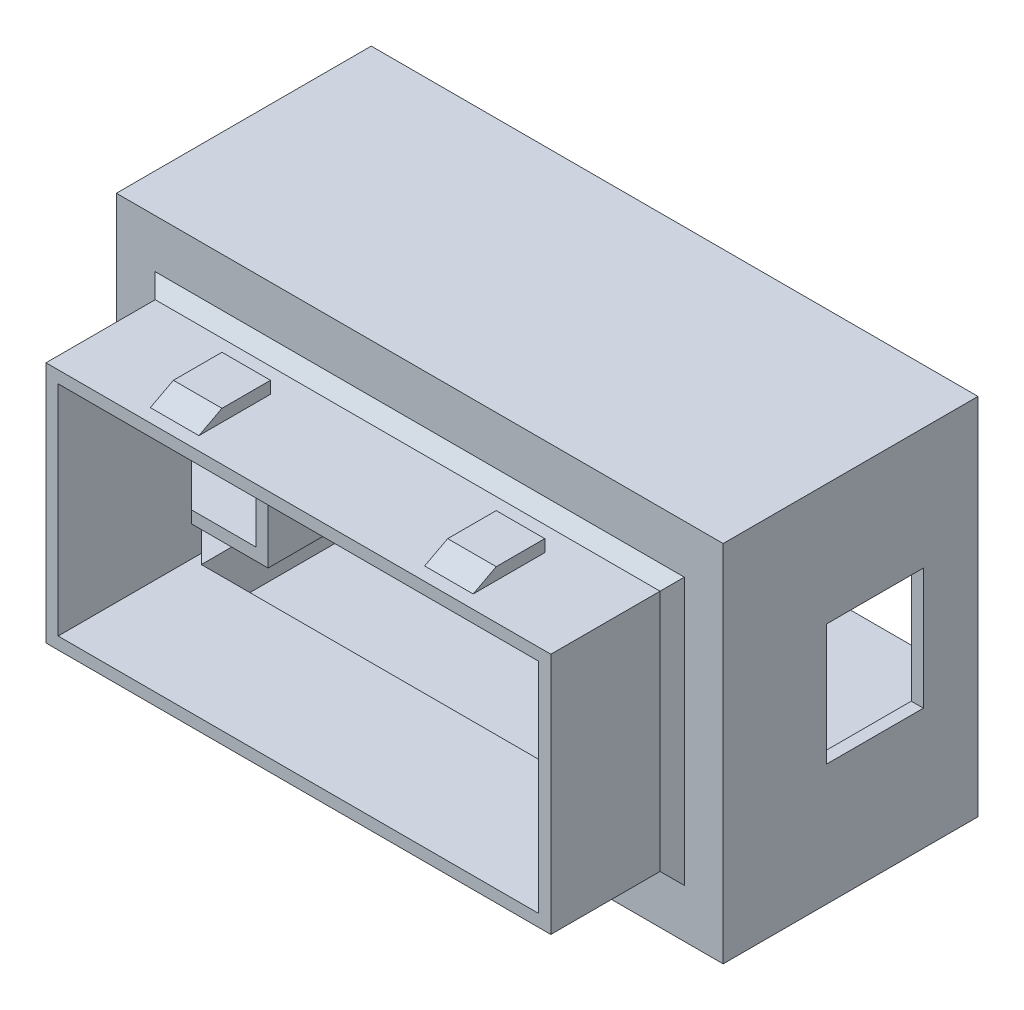
from build123d import *

# Parameters (mm, degrees)
SKETCH1_W            = 41.6
SKETCH1_H            = 20
SKETCH1_W_2          = 39.6
SKETCH1_H_2          = 18
BOSS_EXTRUDE2_DEPTH  = 10
SKETCH2_W            = 4
SKETCH2_H            = 10
BOSS_EXTRUDE3_DEPTH  = 1
SKETCH3_W            = 3
SKETCH3_H            = 1
CUT_EXTRUDE1_DEPTH   = 27
SKETCH4_W            = 4
SKETCH4_H            = 10
BOSS_EXTRUDE4_DEPTH  = 1
SKETCH5_W            = 3
SKETCH5_H            = 1
CUT_EXTRUDE2_DEPTH   = 27
SKETCH6_W            = 50
SKETCH6_H            = 30
SKETCH6_W_2          = 41.6
SKETCH6_H_2          = 20
SKETCH6_W_3          = 39.6
SKETCH6_H_3          = 18
BOSS_EXTRUDE6_DEPTH  = 1
CHAMFER1_SIZE        = 1
SKETCH7_W            = 50
SKETCH7_H            = 30
SKETCH7_W_2          = 48
SKETCH7_H_2          = 28
BOSS_EXTRUDE7_DEPTH  = 20
SKETCH8_W            = 4.2
SKETCH8_H            = 1
BOSS_EXTRUDE8_DEPTH  = 20
SKETCH9_W            = 4.2
SKETCH9_H            = 1
BOSS_EXTRUDE9_DEPTH  = 20
SKETCH10_W           = 4
SKETCH10_H           = 4
BOSS_EXTRUDE10_DEPTH = 20
SKETCH11_W           = 2
SKETCH11_H           = 10
CUT_EXTRUDE3_DEPTH   = 1
SKETCH12_W           = 2
SKETCH12_H           = 10
CUT_EXTRUDE4_DEPTH   = 1
SKETCH13_R           = 1.5
CUT_EXTRUDE5_DEPTH   = 10
CHAMFER2_SIZE        = 5
CHAMFER3_SIZE        = 5
CHAMFER4_SIZE        = 4
SKETCH17_W           = 20
SKETCH17_H           = 14
CUT_EXTRUDE8_DEPTH   = 10
SKETCH18_W           = 4.2
SKETCH18_H           = 1
BOSS_EXTRUDE11_DEPTH = 20
CHAMFER5_SIZE        = 5
CHAMFER6_SIZE        = 5
CHAMFER7_SIZE        = 4
SKETCH19_W           = 20
SKETCH19_H           = 14
CUT_EXTRUDE9_DEPTH   = 10
SKETCH20_W           = 4.2
SKETCH20_H           = 1
BOSS_EXTRUDE12_DEPTH = 20
CHAMFER8_SIZE        = 4
CHAMFER9_SIZE        = 5


# Some blends are built 0.0001 mm under size
with BuildPart() as part:
    # Sketch1 → Boss-Extrude2 (new body)
    with BuildSketch(Plane.XY):
        Rectangle(SKETCH1_W, SKETCH1_H)
        Rectangle(SKETCH1_W_2, SKETCH1_H_2, mode=Mode.SUBTRACT)
    extrude(amount=BOSS_EXTRUDE2_DEPTH)

    # Sketch2 → Boss-Extrude3 (add)
    with BuildSketch(Plane.XZ.offset(10)):
        with Locations((-11.3, 5)):
            Rectangle(SKETCH2_W, SKETCH2_H)
        with Locations((11.3, 5)):
            Rectangle(SKETCH2_W, SKETCH2_H)
    extrude(amount=BOSS_EXTRUDE3_DEPTH)

    # Sketch3 → Cut-Extrude1 (cut)
    with BuildSketch(Plane.ZY.offset(13.3)):
        Polygon((8.900149248, -10), (7, -11), (10, -11), (10, -10), align=None)
        with Locations((1.5, -10.5)):
            Rectangle(SKETCH3_W, SKETCH3_H)
    extrude(amount=-CUT_EXTRUDE1_DEPTH, mode=Mode.SUBTRACT)

    # Sketch4 → Boss-Extrude4 (add)
    with BuildSketch(Plane(origin=(0, 10, 0), x_dir=(1, 0, 0), z_dir=(0, 1, 0))):
        with Locations((11.3, -5)):
            Rectangle(SKETCH4_W, SKETCH4_H)
        with Locations((-11.3, -5)):
            Rectangle(SKETCH4_W, SKETCH4_H)
    extrude(amount=BOSS_EXTRUDE4_DEPTH)

    # Sketch5 → Cut-Extrude2 (cut)
    with BuildSketch(Plane(origin=(13.3, 0, 0), x_dir=(0, 0, -1), z_dir=(1, 0, 0))):
        Polygon((-7, 11), (-10, 11), (-10, 10), (-8.900149248, 10), align=None)
        with Locations((-1.5, 10.5)):
            Rectangle(SKETCH5_W, SKETCH5_H)
    extrude(amount=-CUT_EXTRUDE2_DEPTH, mode=Mode.SUBTRACT)

    # Sketch6 → Boss-Extrude6 (add)
    # profile 1 of 2: a face of its own
    with BuildSketch(Plane(origin=(0, 0, 0), x_dir=(-1, 0, 0), z_dir=(0, 0, -1))):
        Rectangle(SKETCH6_W, SKETCH6_H)
        Rectangle(SKETCH6_W_2, SKETCH6_H_2, mode=Mode.SUBTRACT)
    # profile 2 of 2: a face of its own
    with BuildSketch(Plane(origin=(0, 0, 0), x_dir=(-1, 0, 0), z_dir=(0, 0, -1))):
        Rectangle(SKETCH6_W_2, SKETCH6_H_2)
        Rectangle(SKETCH6_W_3, SKETCH6_H_3, mode=Mode.SUBTRACT)
    extrude(amount=BOSS_EXTRUDE6_DEPTH)

    # Chamfer1
    chamfer1_edges = [part.edges().sort_by_distance(p)[0] for p in [
        (0, -10, 0),
        (-20.8, 0, 0),
        (0, 10, 0),
        (20.8, 0, 0),
    ]]
    chamfer(chamfer1_edges, length=CHAMFER1_SIZE)

    # Sketch7 → Boss-Extrude7 (add)
    with BuildSketch(Plane(origin=(0, 0, -1), x_dir=(-1, 0, 0), z_dir=(0, 0, -1))):
        Rectangle(SKETCH7_W, SKETCH7_H)
        Rectangle(SKETCH7_W_2, SKETCH7_H_2, mode=Mode.SUBTRACT)
    extrude(amount=BOSS_EXTRUDE7_DEPTH)

    # Sketch8 → Boss-Extrude8 (add)
    with BuildSketch(Plane(origin=(0, 0, -1), x_dir=(-1, 0, 0), z_dir=(0, 0, -1))):
        Polygon((-15, -5), (-19.8, -5), (-19.8, -6), (-14, -6), (-14, 6), (-19.8, 6), (-19.8, 5), (-15, 5), align=None)
        with Locations((-21.9, 5.5)):
            Rectangle(SKETCH8_W, SKETCH8_H)
        with Locations((-21.9, -5.5)):
            Rectangle(SKETCH8_W, SKETCH8_H)
    extrude(amount=BOSS_EXTRUDE8_DEPTH)

    # Sketch9 → Boss-Extrude9 (add)
    with BuildSketch(Plane(origin=(0, 0, -1), x_dir=(-1, 0, 0), z_dir=(0, 0, -1))):
        Polygon((15, 5), (19.8, 5), (19.8, 6), (14, 6), (14, -6), (19.8, -6), (19.8, -5), (15, -5), align=None)
        with Locations((21.9, 5.5)):
            Rectangle(SKETCH9_W, SKETCH9_H)
        with Locations((21.9, -5.5)):
            Rectangle(SKETCH9_W, SKETCH9_H)
    extrude(amount=BOSS_EXTRUDE9_DEPTH)

    # Sketch10 → Boss-Extrude10 (add)
    with BuildSketch(Plane(origin=(0, 0, -1), x_dir=(-1, 0, 0), z_dir=(0, 0, -1))):
        with Locations((-22, 12)):
            Rectangle(SKETCH10_W, SKETCH10_H)
        with Locations((22, 12)):
            Rectangle(SKETCH10_W, SKETCH10_H)
        with Locations((22, -12)):
            Rectangle(SKETCH10_W, SKETCH10_H)
        with Locations((-22, -12)):
            Rectangle(SKETCH10_W, SKETCH10_H)
    extrude(amount=BOSS_EXTRUDE10_DEPTH)

    # Sketch11 → Cut-Extrude3 (cut)
    with BuildSketch(Plane.ZY.offset(25)):
        Polygon((-10.5, -5), (-10.5, 5), (-16.5, 5), (-16.5, 0), (-16.5, -5), align=None)
        with Locations((-9.5, 0)):
            Rectangle(SKETCH11_W, SKETCH11_H)
    extrude(amount=-CUT_EXTRUDE3_DEPTH, mode=Mode.SUBTRACT)

    # Sketch12 → Cut-Extrude4 (cut)
    with BuildSketch(Plane(origin=(25, 0, 0), x_dir=(0, 0, -1), z_dir=(1, 0, 0))):
        with Locations((9.5, 0)):
            Rectangle(SKETCH12_W, SKETCH12_H)
        Polygon((16.5, 5), (10.5, 5), (10.5, -5), (16.5, -5), (16.5, 0), align=None)
    extrude(amount=-CUT_EXTRUDE4_DEPTH, mode=Mode.SUBTRACT)

    # Sketch13 → Cut-Extrude5 (cut)
    with BuildSketch(Plane(origin=(0, 0, -21), x_dir=(-1, 0, 0), z_dir=(0, 0, -1))):
        with Locations((-22.5, 12.5)):
            Circle(SKETCH13_R)
        with Locations((22.5, 12.5)):
            Circle(SKETCH13_R)
        with Locations((22.5, -12.5)):
            Circle(SKETCH13_R)
        with Locations((-22.5, -12.5)):
            Circle(SKETCH13_R)
    extrude(amount=-CUT_EXTRUDE5_DEPTH, mode=Mode.SUBTRACT)

    # Chamfer2
    chamfer2_edges = [part.edges().sort_by_distance(p)[0] for p in [
        (0, -14, -1),
        (0, 14, -1),
    ]]
    chamfer(chamfer2_edges, length=CHAMFER2_SIZE - 0.0001)  # a hair under: the kernel refuses the full size

    # Chamfer3
    # the kernel refuses this chamfer: 5 mm, written as the material it adds along each edge
    with BuildSketch(Plane(origin=(24, -21.85851494, -1), x_dir=(-0.9996219169112968, 0, 0.02749587661058636), z_dir=(0, 1, 0))) as chamfer3_piece_1_section:
        Polygon((CHAMFER3_SIZE * 0.999621916911, -CHAMFER3_SIZE * 0.0274958766106), (-CHAMFER3_SIZE * 0.0274958766106, -CHAMFER3_SIZE * 0.999621916911), (0, 0), align=None)
    chamfer3_piece_1 = extrude(amount=28.71692988, mode=Mode.PRIVATE)
    chamfer3_piece_1 = split(chamfer3_piece_1, bisect_by=Plane(origin=(19.8, -10.000025, -1.99995), z_dir=(1, 0, 0)), keep=Keep.TOP, mode=Mode.PRIVATE)
    chamfer3_piece_1 = split(chamfer3_piece_1, bisect_by=Plane(origin=(19.999975, -5, -1.99995), z_dir=(0, -1, 0)), keep=Keep.TOP, mode=Mode.PRIVATE)
    chamfer3_piece_1 = split(chamfer3_piece_1, bisect_by=Plane(origin=(19.999975, -10.0000375, -1.9999375), z_dir=(0, 0.7071067811865476, -0.7071067811865476)), keep=Keep.TOP, mode=Mode.PRIVATE)
    add(chamfer3_piece_1)
    with BuildSketch(Plane(origin=(24, -21.85851494, -1), x_dir=(-0.9996219169112968, 0, 0.02749587661058636), z_dir=(0, 1, 0))) as chamfer3_piece_2_section:
        Polygon((CHAMFER3_SIZE * 0.999621916911, -CHAMFER3_SIZE * 0.0274958766106), (-CHAMFER3_SIZE * 0.0274958766106, -CHAMFER3_SIZE * 0.999621916911), (0, 0), align=None)
    chamfer3_piece_2 = extrude(amount=28.71692988, mode=Mode.PRIVATE)
    chamfer3_piece_2 = split(chamfer3_piece_2, bisect_by=Plane(origin=(19.599975009, -9, -1.399950019), z_dir=(0, -1, 0)), keep=Keep.TOP, mode=Mode.PRIVATE)
    chamfer3_piece_2 = split(chamfer3_piece_2, bisect_by=Plane(origin=(19.599975009, -9.300037514, -1.299937514), z_dir=(0, 0.7071067811865476, -0.7071067811865476)), keep=Keep.TOP, mode=Mode.PRIVATE)
    add(chamfer3_piece_2)
    with BuildSketch(Plane(origin=(24, -21.85851494, -1), x_dir=(-0.9996219169112968, 0, 0.02749587661058636), z_dir=(0, 1, 0))) as chamfer3_piece_3_section:
        Polygon((CHAMFER3_SIZE * 0.999621916911, -CHAMFER3_SIZE * 0.0274958766106), (-CHAMFER3_SIZE * 0.0274958766106, -CHAMFER3_SIZE * 0.999621916911), (0, 0), align=None)
    chamfer3_piece_3 = extrude(amount=28.71692988, mode=Mode.PRIVATE)
    chamfer3_piece_3 = split(chamfer3_piece_3, bisect_by=Plane(origin=(19.8, 6.42920747, -1.451851852), z_dir=(1, 0, 0)), keep=Keep.TOP, mode=Mode.PRIVATE)
    chamfer3_piece_3 = split(chamfer3_piece_3, bisect_by=Plane(origin=(19.903703704, 5, -1.451851852), z_dir=(0, 1, 0)), keep=Keep.TOP, mode=Mode.PRIVATE)
    add(chamfer3_piece_3)
    with BuildSketch(Plane(origin=(-24, 6.85841494, -1), x_dir=(0.9996219169112968, 0, 0.02749587661058636), z_dir=(0, -1, 0))) as chamfer3_piece_4_section:
        Polygon((CHAMFER3_SIZE * 0.999621916911, -CHAMFER3_SIZE * 0.0274958766106), (-CHAMFER3_SIZE * 0.0274958766106, -CHAMFER3_SIZE * 0.999621916911), (0, 0), align=None)
    chamfer3_piece_4 = extrude(amount=28.71692988, mode=Mode.PRIVATE)
    chamfer3_piece_4 = split(chamfer3_piece_4, bisect_by=Plane(origin=(-19.8, 6.42920747, -1.451851852), z_dir=(-1, 0, 0)), keep=Keep.TOP, mode=Mode.PRIVATE)
    chamfer3_piece_4 = split(chamfer3_piece_4, bisect_by=Plane(origin=(-19.903703704, 5, -1.451851852), z_dir=(0, 1, 0)), keep=Keep.TOP, mode=Mode.PRIVATE)
    add(chamfer3_piece_4)
    with BuildSketch(Plane(origin=(-24, -6, -1), x_dir=(0.9996219169112968, 0, 0.02749587661058636), z_dir=(0, -1, 0))) as chamfer3_piece_5_section:
        Polygon((CHAMFER3_SIZE * 0.999621916911, -CHAMFER3_SIZE * 0.0274958766106), (-CHAMFER3_SIZE * 0.0274958766106, -CHAMFER3_SIZE * 0.999621916911), (0, 0), align=None)
    chamfer3_piece_5 = extrude(amount=15.85851494, mode=Mode.PRIVATE)
    chamfer3_piece_5 = split(chamfer3_piece_5, bisect_by=Plane(origin=(-19.8, -7.5, -1.451851852), z_dir=(-1, 0, 0)), keep=Keep.TOP, mode=Mode.PRIVATE)
    chamfer3_piece_5 = split(chamfer3_piece_5, bisect_by=Plane(origin=(-19.903703704, -8.475975926, -0.475875926), z_dir=(0, 0.7071067811865476, -0.7071067811865476)), keep=Keep.TOP, mode=Mode.PRIVATE)
    add(chamfer3_piece_5)
    with BuildSketch(Plane(origin=(-24, 6.85841494, -1), x_dir=(0.9996219169112968, 0, 0.02749587661058636), z_dir=(0, -1, 0))) as chamfer3_piece_6_section:
        Polygon((CHAMFER3_SIZE * 0.999621916911, -CHAMFER3_SIZE * 0.0274958766106), (-CHAMFER3_SIZE * 0.0274958766106, -CHAMFER3_SIZE * 0.999621916911), (0, 0), align=None)
    chamfer3_piece_6 = extrude(amount=28.71692988, mode=Mode.PRIVATE)
    chamfer3_piece_6 = split(chamfer3_piece_6, bisect_by=Plane(origin=(-19.599975009, -9, -1.399950019), z_dir=(0, -1, 0)), keep=Keep.TOP, mode=Mode.PRIVATE)
    chamfer3_piece_6 = split(chamfer3_piece_6, bisect_by=Plane(origin=(-19.599975009, -9.300037514, -1.299937514), z_dir=(0, 0.7071067811865476, -0.7071067811865476)), keep=Keep.TOP, mode=Mode.PRIVATE)
    add(chamfer3_piece_6)
    with BuildSketch(Plane(origin=(-24, 21.85851494, -1), x_dir=(0.9996219169112968, 0, 0.02749587661058636), z_dir=(0, -1, 0))) as chamfer3_piece_7_section:
        Polygon((CHAMFER3_SIZE * 0.999621916911, -CHAMFER3_SIZE * 0.0274958766106), (-CHAMFER3_SIZE * 0.0274958766106, -CHAMFER3_SIZE * 0.999621916911), (0, 0), align=None)
    chamfer3_piece_7 = extrude(amount=28.71692988, mode=Mode.PRIVATE)
    chamfer3_piece_7 = split(chamfer3_piece_7, bisect_by=Plane(origin=(-19.8, 10.000025, -1.99995), z_dir=(-1, 0, 0)), keep=Keep.TOP, mode=Mode.PRIVATE)
    chamfer3_piece_7 = split(chamfer3_piece_7, bisect_by=Plane(origin=(-19.999975, 15, -1.99995), z_dir=(0, -1, 0)), keep=Keep.TOP, mode=Mode.PRIVATE)
    chamfer3_piece_7 = split(chamfer3_piece_7, bisect_by=Plane(origin=(-19.999975, 5, -1.99995), z_dir=(0, 1, 0)), keep=Keep.TOP, mode=Mode.PRIVATE)
    add(chamfer3_piece_7)
    with BuildSketch(Plane(origin=(-24, 21.85851494, -1), x_dir=(0.9996219169112968, 0, 0.02749587661058636), z_dir=(0, -1, 0))) as chamfer3_piece_8_section:
        Polygon((CHAMFER3_SIZE * 0.999621916911, -CHAMFER3_SIZE * 0.0274958766106), (-CHAMFER3_SIZE * 0.0274958766106, -CHAMFER3_SIZE * 0.999621916911), (0, 0), align=None)
    chamfer3_piece_8 = extrude(amount=28.71692988, mode=Mode.PRIVATE)
    chamfer3_piece_8 = split(chamfer3_piece_8, bisect_by=Plane(origin=(-19.599975009, 9, -1.399950019), z_dir=(0, 1, 0)), keep=Keep.TOP, mode=Mode.PRIVATE)
    chamfer3_piece_8 = split(chamfer3_piece_8, bisect_by=Plane(origin=(-19.599975009, 15, -1.399950019), z_dir=(0, -1, 0)), keep=Keep.TOP, mode=Mode.PRIVATE)
    add(chamfer3_piece_8)
    with BuildSketch(Plane(origin=(-24, 21.85851494, -1), x_dir=(0.9996219169112968, 0, 0.02749587661058636), z_dir=(0, -1, 0))) as chamfer3_piece_9_section:
        Polygon((CHAMFER3_SIZE * 0.999621916911, -CHAMFER3_SIZE * 0.0274958766106), (-CHAMFER3_SIZE * 0.0274958766106, -CHAMFER3_SIZE * 0.999621916911), (0, 0), align=None)
    chamfer3_piece_9 = extrude(amount=28.71692988, mode=Mode.PRIVATE)
    chamfer3_piece_9 = split(chamfer3_piece_9, bisect_by=Plane(origin=(-19.8, -6.42920747, -1.451851852), z_dir=(-1, 0, 0)), keep=Keep.TOP, mode=Mode.PRIVATE)
    chamfer3_piece_9 = split(chamfer3_piece_9, bisect_by=Plane(origin=(-19.903703704, -6, -1.451851852), z_dir=(0, -1, 0)), keep=Keep.TOP, mode=Mode.PRIVATE)
    add(chamfer3_piece_9)
    with BuildSketch(Plane(origin=(24, -6.85841494, -1), x_dir=(-0.9996219169112968, 0, 0.02749587661058636), z_dir=(0, 1, 0))) as chamfer3_piece_10_section:
        Polygon((CHAMFER3_SIZE * 0.999621916911, -CHAMFER3_SIZE * 0.0274958766106), (-CHAMFER3_SIZE * 0.0274958766106, -CHAMFER3_SIZE * 0.999621916911), (0, 0), align=None)
    chamfer3_piece_10 = extrude(amount=28.71692988, mode=Mode.PRIVATE)
    chamfer3_piece_10 = split(chamfer3_piece_10, bisect_by=Plane(origin=(19.8, -6.42920747, -1.451851852), z_dir=(1, 0, 0)), keep=Keep.TOP, mode=Mode.PRIVATE)
    chamfer3_piece_10 = split(chamfer3_piece_10, bisect_by=Plane(origin=(19.903703704, -5, -1.451851852), z_dir=(0, -1, 0)), keep=Keep.TOP, mode=Mode.PRIVATE)
    add(chamfer3_piece_10)
    with BuildSketch(Plane(origin=(24, -6.85841494, -1), x_dir=(-0.9996219169112968, 0, 0.02749587661058636), z_dir=(0, 1, 0))) as chamfer3_piece_11_section:
        Polygon((CHAMFER3_SIZE * 0.999621916911, -CHAMFER3_SIZE * 0.0274958766106), (-CHAMFER3_SIZE * 0.0274958766106, -CHAMFER3_SIZE * 0.999621916911), (0, 0), align=None)
    chamfer3_piece_11 = extrude(amount=28.71692988, mode=Mode.PRIVATE)
    chamfer3_piece_11 = split(chamfer3_piece_11, bisect_by=Plane(origin=(19.8, 7.5, -1.451851852), z_dir=(1, 0, 0)), keep=Keep.TOP, mode=Mode.PRIVATE)
    chamfer3_piece_11 = split(chamfer3_piece_11, bisect_by=Plane(origin=(19.903703704, 15, -1.451851852), z_dir=(0, -1, 0)), keep=Keep.TOP, mode=Mode.PRIVATE)
    chamfer3_piece_11 = split(chamfer3_piece_11, bisect_by=Plane(origin=(19.903703704, 5, -1.451851852), z_dir=(0, 1, 0)), keep=Keep.TOP, mode=Mode.PRIVATE)
    add(chamfer3_piece_11)
    with BuildSketch(Plane(origin=(24, -6.85841494, -1), x_dir=(-0.9996219169112968, 0, 0.02749587661058636), z_dir=(0, 1, 0))) as chamfer3_piece_12_section:
        Polygon((CHAMFER3_SIZE * 0.999621916911, -CHAMFER3_SIZE * 0.0274958766106), (-CHAMFER3_SIZE * 0.0274958766106, -CHAMFER3_SIZE * 0.999621916911), (0, 0), align=None)
    chamfer3_piece_12 = extrude(amount=28.71692988, mode=Mode.PRIVATE)
    chamfer3_piece_12 = split(chamfer3_piece_12, bisect_by=Plane(origin=(19.599975009, 9, -1.399950019), z_dir=(0, 1, 0)), keep=Keep.TOP, mode=Mode.PRIVATE)
    chamfer3_piece_12 = split(chamfer3_piece_12, bisect_by=Plane(origin=(19.599975009, 15, -1.399950019), z_dir=(0, -1, 0)), keep=Keep.TOP, mode=Mode.PRIVATE)
    add(chamfer3_piece_12)

    # Chamfer4
    chamfer4_edges = [part.edges().sort_by_distance(p)[0] for p in [
        (24, 0, -1),
        (-24, 0, -1),
    ]]
    chamfer(chamfer4_edges, length=CHAMFER4_SIZE)

    # Sketch17 → Cut-Extrude8 (cut)
    with BuildSketch(Plane.ZY.offset(-14)):
        with Locations((-11, 0)):
            Rectangle(SKETCH17_W, SKETCH17_H)
    extrude(amount=-CUT_EXTRUDE8_DEPTH, mode=Mode.SUBTRACT)

    # Sketch18 → Boss-Extrude11 (add)
    with BuildSketch(Plane(origin=(0, 0, -1), x_dir=(-1, 0, 0), z_dir=(0, 0, -1))):
        Polygon((-19.8, 6.5), (-19.8, 5.5), (-14.5, 5.5), (-14.5, -5.5), (-19.8, -5.5), (-19.8, -6.5), (-13.5, -6.5), (-13.5, 6.5), align=None)
        with Locations((-21.9, 6)):
            Rectangle(SKETCH18_W, SKETCH18_H)
        with Locations((-21.9, -6)):
            Rectangle(SKETCH18_W, SKETCH18_H)
    extrude(amount=BOSS_EXTRUDE11_DEPTH)

    # Chamfer5
    # the kernel refuses this chamfer: 5 mm, written as the material it adds along each edge
    with BuildSketch(Plane(origin=(24, 19.85841494, -1), x_dir=(-0.9996219169112968, 0, 0.02749587661058636), z_dir=(0, -1, 0))) as chamfer5_piece_1_section:
        Polygon((CHAMFER5_SIZE * 0.999621916911, CHAMFER5_SIZE * 0.0274958766106), (-CHAMFER5_SIZE * 0.0274958766106, CHAMFER5_SIZE * 0.999621916911), (0, 0), align=None)
    chamfer5_piece_1 = extrude(amount=13.35841494, mode=Mode.PRIVATE)
    chamfer5_piece_1 = split(chamfer5_piece_1, bisect_by=Plane(origin=(19.8, 10.000025, -1.99995), z_dir=(1, 0, 0)), keep=Keep.TOP, mode=Mode.PRIVATE)
    chamfer5_piece_1 = split(chamfer5_piece_1, bisect_by=Plane(origin=(19.999975, 15, -1.99995), z_dir=(0, -1, 0)), keep=Keep.TOP, mode=Mode.PRIVATE)
    add(chamfer5_piece_1)

    # Chamfer6
    # the kernel refuses this chamfer: 5 mm, written as the material it adds along each edge
    with BuildSketch(Plane(origin=(24, 6.35841494, -1), x_dir=(0.027495876610586317, 0, -0.9996219169112968), z_dir=(0, -1, 0))) as chamfer6_piece_1_section:
        Polygon((CHAMFER6_SIZE * 0.999621916911, -CHAMFER6_SIZE * 0.0274958766106), (-CHAMFER6_SIZE * 0.0274958766106, -CHAMFER6_SIZE * 0.999621916911), (0, 0), align=None)
    chamfer6_piece_1 = extrude(amount=26.21682988, mode=Mode.PRIVATE)
    chamfer6_piece_1 = split(chamfer6_piece_1, bisect_by=Plane(origin=(19.8, -6.75, -2.722222222), z_dir=(1, 0, 0)), keep=Keep.TOP, mode=Mode.PRIVATE)
    chamfer6_piece_1 = split(chamfer6_piece_1, bisect_by=Plane(origin=(22.444444444, -15, -2.722222222), z_dir=(0, 1, 0)), keep=Keep.TOP, mode=Mode.PRIVATE)
    chamfer6_piece_1 = split(chamfer6_piece_1, bisect_by=Plane(origin=(22.444444444, -5.5, -2.722222222), z_dir=(0, -1, 0)), keep=Keep.TOP, mode=Mode.PRIVATE)
    add(chamfer6_piece_1)

    # Chamfer7
    chamfer7_edges = [part.edges().sort_by_distance(p)[0] for p in [
        (24, 0, -1),
    ]]
    chamfer(chamfer7_edges, length=CHAMFER7_SIZE)

    # Sketch19 → Cut-Extrude9 (cut)
    with BuildSketch(Plane(origin=(-14, 0, 0), x_dir=(0, 0, -1), z_dir=(1, 0, 0))):
        with Locations((11, 0)):
            Rectangle(SKETCH19_W, SKETCH19_H)
    extrude(amount=-CUT_EXTRUDE9_DEPTH, mode=Mode.SUBTRACT)

    # Sketch20 → Boss-Extrude12 (add)
    with BuildSketch(Plane(origin=(0, 0, -1), x_dir=(-1, 0, 0), z_dir=(0, 0, -1))):
        Polygon((14.5, 5.5), (19.8, 5.5), (19.8, 6.5), (13.5, 6.5), (13.5, -6.5), (19.8, -6.5), (19.8, -5.5), (14.5, -5.5), align=None)
        with Locations((21.9, 6)):
            Rectangle(SKETCH20_W, SKETCH20_H)
        with Locations((21.9, -6)):
            Rectangle(SKETCH20_W, SKETCH20_H)
    extrude(amount=BOSS_EXTRUDE12_DEPTH)

    # Chamfer8
    chamfer8_edges = [part.edges().sort_by_distance(p)[0] for p in [
        (-24, 0, -1),
    ]]
    chamfer(chamfer8_edges, length=CHAMFER8_SIZE)

    # Chamfer9
    # the kernel refuses this chamfer: 5 mm, written as the material it adds along each edge
    with BuildSketch(Plane(origin=(-24, -19.85841494, -1), x_dir=(-0.027495876610586317, 0, -0.9996219169112968), z_dir=(0, 1, 0))) as chamfer9_piece_1_section:
        Polygon((CHAMFER9_SIZE * 0.999621916911, -CHAMFER9_SIZE * 0.0274958766106), (-CHAMFER9_SIZE * 0.0274958766106, -CHAMFER9_SIZE * 0.999621916911), (0, 0), align=None)
    chamfer9_piece_1 = extrude(amount=13.35841494, mode=Mode.PRIVATE)
    chamfer9_piece_1 = split(chamfer9_piece_1, bisect_by=Plane(origin=(-19.8, -10.000025, -1.99995), z_dir=(-1, 0, 0)), keep=Keep.TOP, mode=Mode.PRIVATE)
    chamfer9_piece_1 = split(chamfer9_piece_1, bisect_by=Plane(origin=(-19.999975, -10.0000375, -1.9999375), z_dir=(0, 0.7071067811865476, -0.7071067811865476)), keep=Keep.TOP, mode=Mode.PRIVATE)
    add(chamfer9_piece_1)
    with BuildSketch(Plane(origin=(-24, 6.5, -1), x_dir=(-0.027495876610586317, 0, -0.9996219169112968), z_dir=(0, 1, 0))) as chamfer9_piece_2_section:
        Polygon((CHAMFER9_SIZE * 0.999621916911, -CHAMFER9_SIZE * 0.0274958766106), (-CHAMFER9_SIZE * 0.0274958766106, -CHAMFER9_SIZE * 0.999621916911), (0, 0), align=None)
    chamfer9_piece_2 = extrude(amount=13.35841494, mode=Mode.PRIVATE)
    chamfer9_piece_2 = split(chamfer9_piece_2, bisect_by=Plane(origin=(-19.8, 6.75, -3.5), z_dir=(-1, 0, 0)), keep=Keep.TOP, mode=Mode.PRIVATE)
    chamfer9_piece_2 = split(chamfer9_piece_2, bisect_by=Plane(origin=(-22, 9.12505, -1.12495), z_dir=(0, -0.7071067811865476, -0.7071067811865476)), keep=Keep.TOP, mode=Mode.PRIVATE)
    add(chamfer9_piece_2)


solid = part.part
